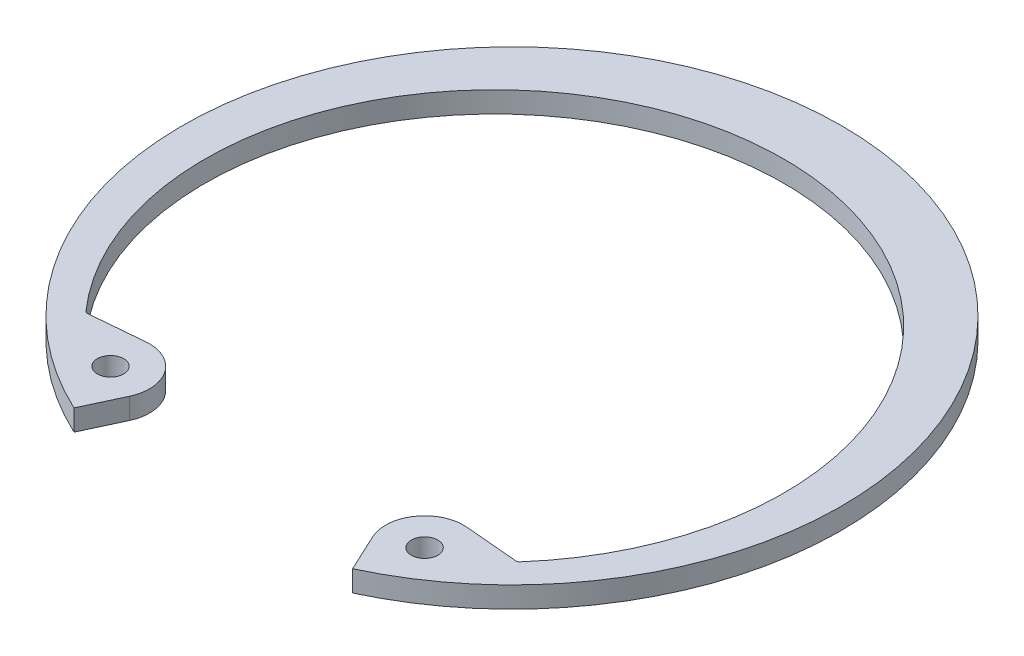
from build123d import *

# Parameters (mm, degrees)
SKETCH2_R      = 0.9906
EXTRUDE1_DEPTH = 1.5748
FILLET1_R      = 0.254


with BuildPart() as part:
    # Sketch2 → Extrude1 (new body)
    with BuildSketch(Plane(origin=(0, 0, 0), x_dir=(1, 0, 0), z_dir=(0, 1, 0))):
        with BuildLine():
            Line((10.423203237, -22.352631475), (9.105434927, -19.526668214))
            ThreePointArc((9.105434927, -19.526668214), (9.360016851, -16.616783501), (12.007341897, -15.382315559))
            Line((12.007341897, -15.382315559), (16.150495139, -15.744794499))
            ThreePointArc((16.150495139, -15.744794499), (0, 20.3454), (-16.150495139, -15.744794499))
            Line((-16.150495139, -15.744794499), (-12.007341897, -15.382315559))
            ThreePointArc((-12.007341897, -15.382315559), (-9.360016851, -16.616783501), (-9.105434927, -19.526668214))
            Line((-9.105434927, -19.526668214), (-10.423203237, -22.352631475))
            ThreePointArc((-10.423203237, -22.352631475), (0, 24.6634), (10.423203237, -22.352631475))
        make_face()
        with Locations((11.752759973, -18.292200272)):
            Circle(SKETCH2_R, mode=Mode.SUBTRACT)
        with Locations((-11.752759973, -18.292200272)):
            Circle(SKETCH2_R, mode=Mode.SUBTRACT)
    extrude(amount=-EXTRUDE1_DEPTH)

    # Fillet1
    fillet1_edges = [part.edges().sort_by_distance(p)[0] for p in [
        (-16.150495139, -0.7874, 15.744794499),
        (16.150495139, -0.7874, 15.744794499),
    ]]
    fillet(fillet1_edges, radius=FILLET1_R)


solid = part.part
